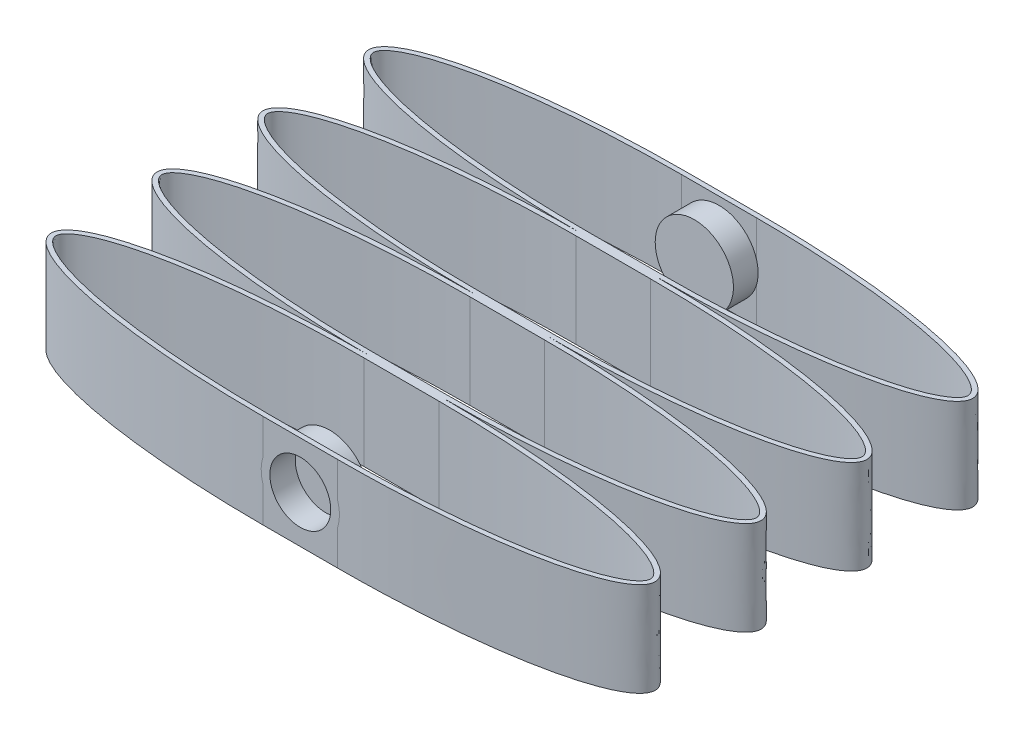
from build123d import *

# Parameters (mm, degrees)
EXTRUDE_THIN1_START = -8
EXTRUDE_THIN1_DEPTH = 16
SKETCH2_R           = 6.65
BOSS_EXTRUDE1_DEPTH = 5
SKETCH5_R           = 5.175
CUT_EXTRUDE1_DEPTH  = 4.318


# Read off the part's stored shape, not the designer's step: Extrude-Thin1
with BuildPart() as part:
    # Extrude-Thin1 outline → Extrude-Thin1 (new body)
    with BuildSketch(Plane(origin=(0, 0, 0), x_dir=(1, 0, 0), z_dir=(0, 1, 0)).offset(EXTRUDE_THIN1_START)):
        with BuildLine():
            Line((6.35, 9), (-6.35, 9))
            add(Edge.make_bspline(
                [(-6.35, 9), (-51.35, 9), (-51.35, 0), (-51.35, -9), (-6.35, -9)],
                knots=[4.71238898, 4.71238898, 4.71238898, 6.283185307, 6.283185307, 7.853981634, 7.853981634, 7.853981634], degree=2, weights=[1, 0.707106781, 1, 0.707106781, 1]))
            Line((-6.35, -9), (6.35, -9))
            add(Edge.make_bspline(
                [(6.35, -9), (51.35, -9), (51.35, 0), (51.35, 9), (6.35, 9)],
                knots=[4.71238898, 4.71238898, 4.71238898, 6.283185307, 6.283185307, 7.853981634, 7.853981634, 7.853981634], degree=2, weights=[1, 0.707106781, 1, 0.707106781, 1]))
        make_face()
        with BuildLine():
            add(Edge.make_bspline(
                [(-6.35, 8.2), (-10.174380765, 8.2), (-13.988093175, 8.103867577), (-21.592314649, 7.702517688), (-25.383030607, 7.399164531), (-31.045299991, 6.72963227), (-32.928707007, 6.470265723), (-36.684519657, 5.852399293), (-38.557092614, 5.495407177), (-41.352554092, 4.839190159), (-42.282113048, 4.600072481), (-44.134501836, 4.061201065), (-45.059898059, 3.76119124), (-46.412407935, 3.242628867), (-46.858015127, 3.058001434), (-47.733929315, 2.654300393), (-48.164477904, 2.435770697), (-48.999709559, 1.940478836), (-49.407859851, 1.664056253), (-49.948053299, 1.170940461), (-50.118212883, 0.991254685), (-50.399547739, 0.590043306), (-50.512974037, 0.366922361), (-50.557469482, -0.001202798), (-50.549174268, -0.124544172), (-50.491622584, -0.364574759), (-50.444631645, -0.477440548), (-50.269212651, -0.80251764), (-50.113345589, -0.992100075), (-49.771193493, -1.342236759), (-49.584320363, -1.5010423), (-49.199093823, -1.794683184), (-48.999193943, -1.93043343), (-48.384821647, -2.31539271), (-47.954372095, -2.543406427), (-47.078590663, -2.961942836), (-46.634577991, -3.151424757), (-45.290574888, -3.681199134), (-44.378825058, -3.983484977), (-42.537613063, -4.530810056), (-41.607827684, -4.774804655), (-39.735682227, -5.222152185), (-38.792068078, -5.425467309), (-36.901682063, -5.799592513), (-35.955098585, -5.970335741), (-33.112031287, -6.443636749), (-31.212274514, -6.707781236), (-25.50351894, -7.388890167), (-21.685187672, -7.6963233), (-14.030776797, -8.102884617), (-10.19452569, -8.2), (-6.35, -8.2)],
                knots=[0, 0, 0, 0, 0.125, 0.125, 0.25, 0.25, 0.3125, 0.3125, 0.375, 0.375, 0.40625, 0.40625, 0.4375, 0.4375, 0.453125, 0.453125, 0.46875, 0.46875, 0.484375, 0.484375, 0.4921875, 0.4921875, 0.5, 0.5, 0.50390625, 0.50390625, 0.5078125, 0.5078125, 0.515625, 0.515625, 0.5234375, 0.5234375, 0.53125, 0.53125, 0.546875, 0.546875, 0.5625, 0.5625, 0.59375, 0.59375, 0.625, 0.625, 0.65625, 0.65625, 0.6875, 0.6875, 0.75, 0.75, 0.875, 0.875, 1, 1, 1, 1], degree=3))
            Line((-6.35, 8.2), (6.35, 8.2))
            add(Edge.make_bspline(
                [(6.35, -8.2), (10.174380765, -8.2), (13.988093175, -8.103867577), (21.592314649, -7.702517688), (25.383030607, -7.399164531), (31.045299991, -6.72963227), (32.928707007, -6.470265723), (36.684519657, -5.852399293), (38.557092614, -5.495407177), (41.352554092, -4.839190159), (42.282113048, -4.600072481), (44.134501836, -4.061201065), (45.059898059, -3.76119124), (46.412407935, -3.242628867), (46.858015127, -3.058001434), (47.733929315, -2.654300393), (48.164477904, -2.435770697), (48.999709559, -1.940478836), (49.407859851, -1.664056253), (49.948053299, -1.170940461), (50.118212883, -0.991254685), (50.399547739, -0.590043306), (50.512974037, -0.366922361), (50.557469482, 0.001202798), (50.549174268, 0.124544172), (50.491622584, 0.364574759), (50.444631645, 0.477440548), (50.269212651, 0.80251764), (50.113345589, 0.992100075), (49.771193493, 1.342236759), (49.584320363, 1.5010423), (49.199093823, 1.794683184), (48.999193943, 1.93043343), (48.384821647, 2.31539271), (47.954372095, 2.543406427), (47.078590663, 2.961942836), (46.634577991, 3.151424757), (45.290574888, 3.681199134), (44.378825058, 3.983484977), (42.537613063, 4.530810056), (41.607827684, 4.774804655), (39.735682227, 5.222152185), (38.792068078, 5.425467309), (36.901682063, 5.799592513), (35.955098585, 5.970335741), (33.112031287, 6.443636749), (31.212274514, 6.707781236), (25.50351894, 7.388890167), (21.685187672, 7.6963233), (14.030776797, 8.102884617), (10.19452569, 8.2), (6.35, 8.2)],
                knots=[0, 0, 0, 0, 0.125, 0.125, 0.25, 0.25, 0.3125, 0.3125, 0.375, 0.375, 0.40625, 0.40625, 0.4375, 0.4375, 0.453125, 0.453125, 0.46875, 0.46875, 0.484375, 0.484375, 0.4921875, 0.4921875, 0.5, 0.5, 0.50390625, 0.50390625, 0.5078125, 0.5078125, 0.515625, 0.515625, 0.5234375, 0.5234375, 0.53125, 0.53125, 0.546875, 0.546875, 0.5625, 0.5625, 0.59375, 0.59375, 0.625, 0.625, 0.65625, 0.65625, 0.6875, 0.6875, 0.75, 0.75, 0.875, 0.875, 1, 1, 1, 1], degree=3))
            Line((6.35, -8.2), (-6.35, -8.2))
        make_face(mode=Mode.SUBTRACT)
    extrude_thin1 = extrude(amount=EXTRUDE_THIN1_DEPTH)

    # Sketch2 → Boss-Extrude1 (add)
    with BuildSketch(Plane(origin=(0, 0, -9), x_dir=(-1, 0, 0), z_dir=(0, 0, -1))):
        Circle(SKETCH2_R)
    extrude(amount=-BOSS_EXTRUDE1_DEPTH)

    # Sketch5 → Cut-Extrude1 (cut)
    with BuildSketch(Plane(origin=(0, 0, -9), x_dir=(-1, 0, 0), z_dir=(0, 0, -1))):
        Circle(SKETCH5_R)
    extrude(amount=-CUT_EXTRUDE1_DEPTH, mode=Mode.SUBTRACT)

    # Mirror3: Extrude-Thin1 across plane
    add(extrude_thin1.mirror(Plane(origin=(-6.35, 8, 9), x_dir=(1, 0, 0), z_dir=(0, 0, -1))))

    # Mirror5: part across plane


with BuildPart() as part_1:
    add(part.part)
    add(part.part.mirror(Plane(origin=(-6.35, 8, 27), x_dir=(1, 0, 0), z_dir=(0, 0, 1))))


solid = part_1.part
